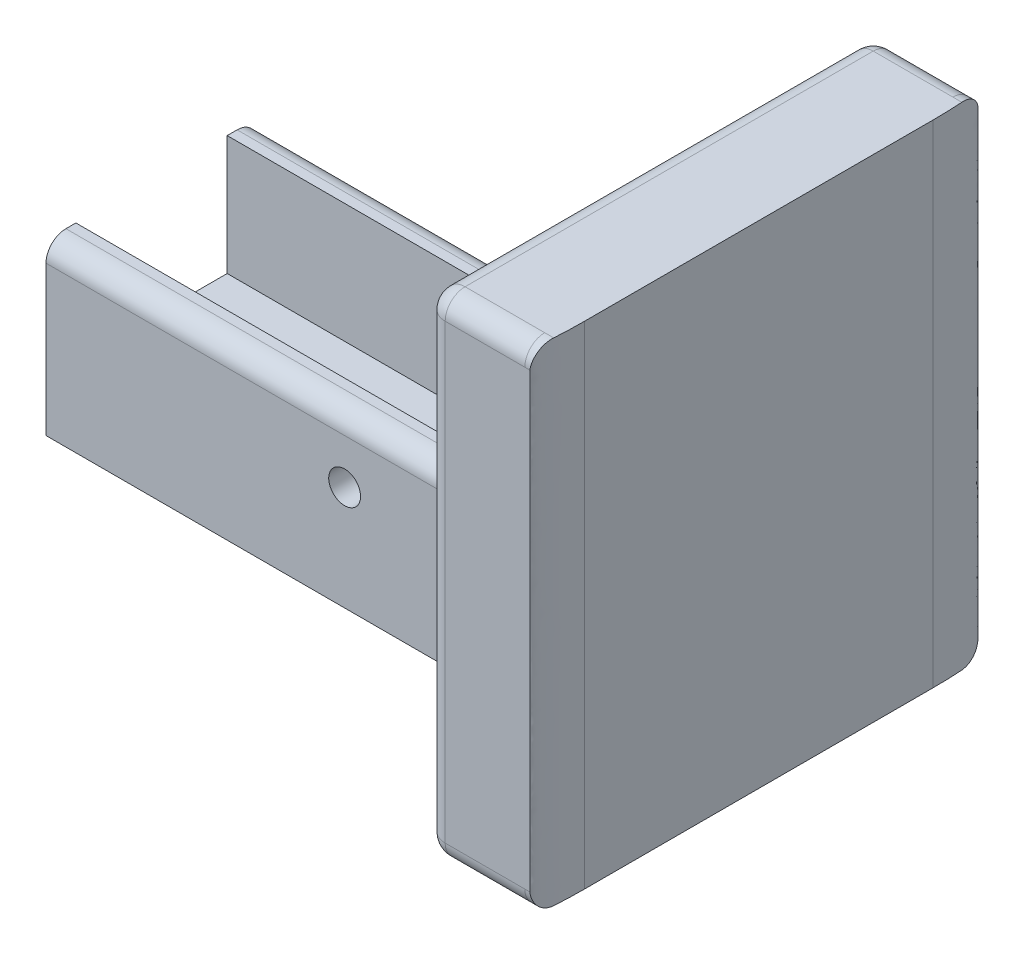
from build123d import *

# Parameters (mm, degrees)
EXTRUDE_1_OUTLINE_W = 50
EXTRUDE_1_OUTLINE_H = 5
EXTRUDE_1_DEPTH     = 21.2
SKETCH_3_W          = 45
SKETCH_3_H          = 49.4
EXTRUDE_1_2_DEPTH   = 10
CUT_EXTRUDE_1_DEPTH = 57
SKETCH_5_W          = 50
SKETCH_5_H          = 3
EXTRUDE_2_DEPTH     = 12
SKETCH_8_R          = 1.6
CUT_EXTRUDE_2_DEPTH = 95.509364615
FILLET_1_R          = 2
SKETCH_9_W          = 45
SKETCH_9_H          = 49.4
EXTRUDE_3_DEPTH     = 1
FILLET_2_R          = 2
FILLET_3_SIZE       = 5
FILLET_3_SIZE_2     = 0.5


with BuildPart() as part:
    # Extrude 1: read off the stored shape, not the designer's step
    # Extrude 1 outline → Extrude 1 (new body)
    with BuildSketch(Plane.XY):
        with Locations((45, -3.5)):
            Rectangle(EXTRUDE_1_OUTLINE_W, EXTRUDE_1_OUTLINE_H)
    extrude(amount=EXTRUDE_1_DEPTH)

    # 草图3 → Extrude 1 2 (add)
    with BuildSketch(Plane(origin=(70, 0, 0), x_dir=(0, 0, -1), z_dir=(1, 0, 0))):
        with Locations((-10.6, 13.2)):
            Rectangle(SKETCH_3_W, SKETCH_3_H)
    extrude(amount=EXTRUDE_1_2_DEPTH)

    # 草图4 → 切除-拉伸1 (cut)
    with BuildSketch(Plane.ZY.offset(-20)):
        Polygon((10.6, -6), (13.325, -6), (14.875, -2.9), (6.325, -2.9), (7.875, -6), align=None)
    extrude(amount=-CUT_EXTRUDE_1_DEPTH, mode=Mode.SUBTRACT)

    # 草图5 → 凸台-拉伸2 (add)
    with BuildSketch(Plane(origin=(0, -1, 0), x_dir=(1, 0, 0), z_dir=(0, 1, 0))):
        with Locations((45, -1.5)):
            Rectangle(SKETCH_5_W, SKETCH_5_H)
        with Locations((45, -19.7)):
            Rectangle(SKETCH_5_W, SKETCH_5_H)
    extrude(amount=EXTRUDE_2_DEPTH)

    # 草图8 → 切除-拉伸2 (cut, through all)
    with BuildSketch(Plane.XY.offset(21.2)):
        with Locations((50, 4.5)):
            Circle(SKETCH_8_R)
    extrude(amount=-CUT_EXTRUDE_2_DEPTH, mode=Mode.SUBTRACT)

    # 圆角1
    fillet_1_edges = [part.edges().sort_by_distance(p)[0] for p in [
        (70, 13.2, 33.1),
        (75, 37.9, 33.1),
        (70, -11.5, 10.6),
        (75, -11.5, 33.1),
        (70, 13.2, -11.9),
        (75, -11.5, -11.9),
        (70, 37.9, 10.6),
        (75, 37.9, -11.9),
        (45, 11, 0),
        (45, 11, 21.2),
    ]]
    fillet(fillet_1_edges, radius=FILLET_1_R)

    # 草图9 → 凸台-拉伸3 (add)
    with BuildSketch(Plane(origin=(80, 0, 0), x_dir=(0, 0, -1), z_dir=(1, 0, 0))):
        with Locations((-10.6, 13.2)):
            Rectangle(SKETCH_9_W, SKETCH_9_H)
    extrude(amount=EXTRUDE_3_DEPTH)

    # 圆角2
    fillet_2_edges = [part.edges().sort_by_distance(p)[0] for p in [
        (80.5, 37.9, 33.1),
        (80.5, -11.5, 33.1),
        (80.5, -11.5, -11.9),
        (80.5, 37.9, -11.9),
    ]]
    fillet(fillet_2_edges, radius=FILLET_2_R)

    # 圆角3
    # a fillet whose section is not a circle: 5, 0.5 mm, written as the material it takes off along each edge
    with BuildSketch(Plane(origin=(81, 48.4, -11.9), x_dir=(0, 0, 1), z_dir=(0, -1, 0)), Plane(origin=(81, -22, 33.1), x_dir=(0, 0, -1), z_dir=(0, 1, 0))) as fillet_3_piece_1:
        with BuildLine():
            Bezier((FILLET_3_SIZE, 0), (0, 0), (0, FILLET_3_SIZE_2), weights=[1, 0.707106781, 1])
            Line((0, FILLET_3_SIZE_2), (0, 0))
            Line((0, 0), (FILLET_3_SIZE, 0))
        make_face()
    extrude(amount=70.4, mode=Mode.SUBTRACT)


solid = part.part
